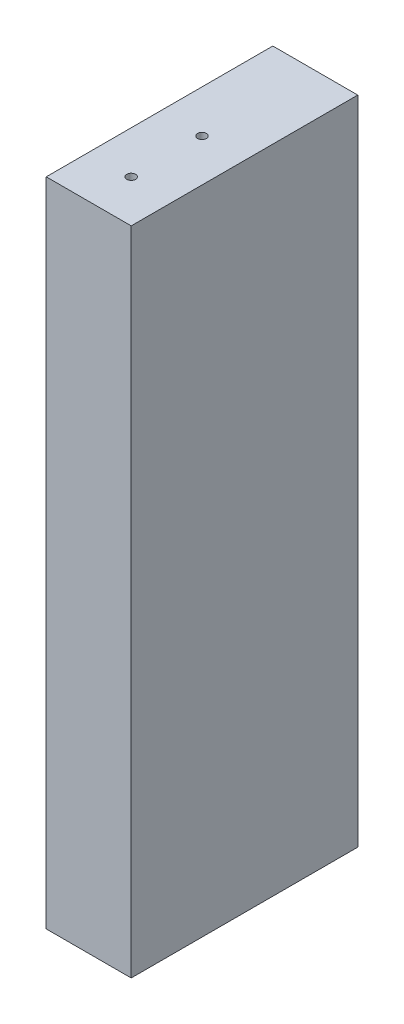
from build123d import *

# Parameters (mm, degrees)
SKETCH1_W                           = 19.05
SKETCH1_H                           = 146.05
BOSS_EXTRUDE1_DEPTH                 = 50.8
F_5_64_0_07813_DIAMETER_HOLE1_D     = 1.984502
F_5_64_0_07813_DIAMETER_HOLE1_DEPTH = 38.1
F_5_64_0_07813_DIAMETER_HOLE1_TIP   = 0.59620455
F_5_64_0_07813_DIAMETER_HOLE2_D     = 1.984502
F_5_64_0_07813_DIAMETER_HOLE2_DEPTH = 38.1
F_5_64_0_07813_DIAMETER_HOLE2_TIP   = 0.59620455
F_5_64_0_07813_DIAMETER_HOLE3_D     = 1.984502
F_5_64_0_07813_DIAMETER_HOLE3_DEPTH = 19.05
F_5_64_0_07813_DIAMETER_HOLE3_TIP   = 0.59620455
F_5_64_0_07813_DIAMETER_HOLE4_D     = 1.984502
F_5_64_0_07813_DIAMETER_HOLE4_DEPTH = 19.05
F_5_64_0_07813_DIAMETER_HOLE4_TIP   = 0.59620455


with BuildPart() as part:
    # Sketch1 → Boss-Extrude1 (new body)
    with BuildSketch(Plane.XY):
        with Locations((472.231312422, 6358.255)):
            Rectangle(SKETCH1_W, SKETCH1_H)
    extrude(amount=BOSS_EXTRUDE1_DEPTH)

    # 5/64 (0.07813) Diameter Hole1
    with Locations(Plane(origin=(0, 1.6e-08, -19.050112211), x_dir=(-1, 0, 0), z_dir=(0, 8.559955098618183e-10, -1.0))):
        with Locations((-481.589248274, 6993.254992531), (-386.339248274, 6993.254992531), (-291.089248274, 6993.254992531), (-295.274999999, 6965.135938474), (-295.274999999, 6812.735938474), (-295.274999999, 6660.335938474), (-285.166362357, 6631.468843414), (-475.477307398, 6631.468752771), (-485.002307398, 6660.335938474), (-485.002307398, 6812.735938474), (-485.002307398, 6965.135938474), (-478.365617646, 6611.6708), (-287.865617646, 6611.6708), (-307.975, 6564.3379), (-307.975, 6488.1379), (-284.960913066, 6440.805), (-380.210913066, 6440.805), (-475.460913066, 6440.805), (-446.831312422, 6488.1379), (-446.831312422, 6564.3379), (-472.231312422, 6396.355), (-472.231312422, 6320.155), (-472.653156211, 6275.705000839), (-377.403156211, 6275.705000839), (-282.153156211, 6275.705000839), (-282.575, 6320.155), (-282.575, 6396.355), (-435.598646187, 6221.729999816), (-435.598646187, 6145.529999816), (-450.592518112, 6091.554999951), (-460.998646187, 6091.555478285), (-460.998646187, 6056.629999944), (-460.998646187, 5980.429999944), (-460.998646187, 5945.505000042), (-282.153156211, 5945.505000042), (-368.611823093, 5945.505000042)):
            Hole(F_5_64_0_07813_DIAMETER_HOLE1_D / 2, depth=F_5_64_0_07813_DIAMETER_HOLE1_DEPTH)
            with Locations((0, 0, -(F_5_64_0_07813_DIAMETER_HOLE1_DEPTH + F_5_64_0_07813_DIAMETER_HOLE1_TIP / 2))):  # 118° drill point
                Cone(0, F_5_64_0_07813_DIAMETER_HOLE1_D / 2, F_5_64_0_07813_DIAMETER_HOLE1_TIP, mode=Mode.SUBTRACT)

    # 5/64 (0.07813) Diameter Hole2
    with Locations(Plane(origin=(189.656312422, 1.6e-08, -19.050112211), x_dir=(-1, 0, 0), z_dir=(0, 8.559955098618183e-10, -1.0))):
        with Locations((-481.589248274, 6993.254992531), (-386.339248274, 6993.254992531), (-291.089248274, 6993.254992531), (-295.274999999, 6965.135938474), (-295.274999999, 6812.735938474), (-295.274999999, 6660.335938474), (-285.166362357, 6631.468843414), (-475.477307398, 6631.468752771), (-485.002307398, 6660.335938474), (-485.002307398, 6812.735938474), (-485.002307398, 6965.135938474), (-478.365617646, 6611.6708), (-287.865617646, 6611.6708), (-307.975, 6564.3379), (-307.975, 6488.1379), (-284.960913066, 6440.805), (-380.210913066, 6440.805), (-475.460913066, 6440.805), (-446.831312422, 6488.1379), (-446.831312422, 6564.3379), (-472.231312422, 6396.355), (-472.231312422, 6320.155), (-472.653156211, 6275.705000839), (-377.403156211, 6275.705000839), (-282.153156211, 6275.705000839), (-282.575, 6320.155), (-282.575, 6396.355), (-435.598646187, 6221.729999816), (-435.598646187, 6145.529999816), (-450.592518112, 6091.554999951), (-460.998646187, 6091.555478285), (-460.998646187, 6056.629999944), (-460.998646187, 5980.429999944), (-460.998646187, 5945.505000042), (-282.153156211, 5945.505000042), (-368.611823093, 5945.505000042)):
            Hole(F_5_64_0_07813_DIAMETER_HOLE2_D / 2, depth=F_5_64_0_07813_DIAMETER_HOLE2_DEPTH)
            with Locations((0, 0, -(F_5_64_0_07813_DIAMETER_HOLE2_DEPTH + F_5_64_0_07813_DIAMETER_HOLE2_TIP / 2))):  # 118° drill point
                Cone(0, F_5_64_0_07813_DIAMETER_HOLE2_D / 2, F_5_64_0_07813_DIAMETER_HOLE2_TIP, mode=Mode.SUBTRACT)

    # 5/64 (0.07813) Diameter Hole3
    with Locations(Plane(origin=(0, 6431.28, 0), x_dir=(1, 0, 0), z_dir=(0, 1, 0))):
        with Locations((472.231312422, -41.275), (472.231312422, -25.4)):
            Hole(F_5_64_0_07813_DIAMETER_HOLE3_D / 2, depth=F_5_64_0_07813_DIAMETER_HOLE3_DEPTH)
            with Locations((0, 0, -(F_5_64_0_07813_DIAMETER_HOLE3_DEPTH + F_5_64_0_07813_DIAMETER_HOLE3_TIP / 2))):  # 118° drill point
                Cone(0, F_5_64_0_07813_DIAMETER_HOLE3_D / 2, F_5_64_0_07813_DIAMETER_HOLE3_TIP, mode=Mode.SUBTRACT)

    # 5/64 (0.07813) Diameter Hole4
    with Locations(Plane(origin=(0, 6285.23, 0), x_dir=(-1, 0, 0), z_dir=(0, -1, 0))):
        with Locations((-472.231312422, -25.4), (-472.231312422, -41.275)):
            Hole(F_5_64_0_07813_DIAMETER_HOLE4_D / 2, depth=F_5_64_0_07813_DIAMETER_HOLE4_DEPTH)
            with Locations((0, 0, -(F_5_64_0_07813_DIAMETER_HOLE4_DEPTH + F_5_64_0_07813_DIAMETER_HOLE4_TIP / 2))):  # 118° drill point
                Cone(0, F_5_64_0_07813_DIAMETER_HOLE4_D / 2, F_5_64_0_07813_DIAMETER_HOLE4_TIP, mode=Mode.SUBTRACT)


solid = part.part
